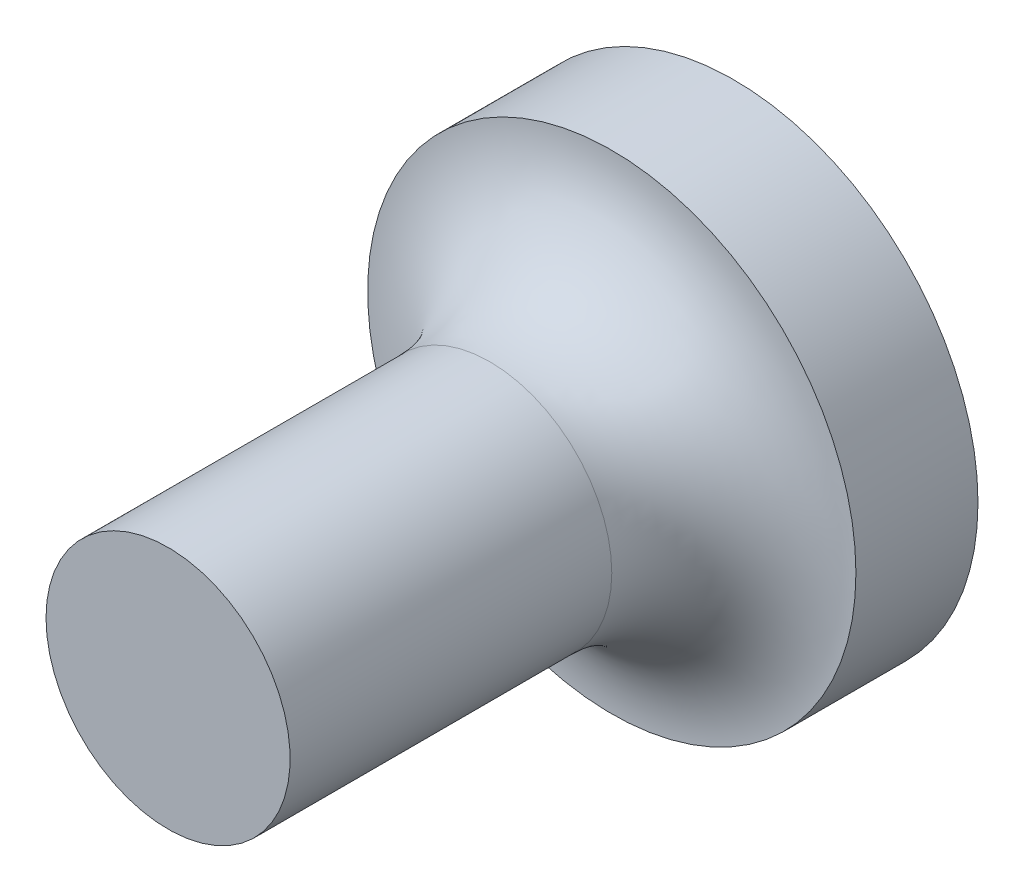
from build123d import *

# Parameters (mm, degrees)
ESQUISSE1_R        = 10
BOSS_EXTRU_1_DEPTH = 52.35
BOSS_EXTRU_2_START = 6
ESQUISSE2_R        = 20
BOSS_EXTRU_2_DEPTH = 10
CONG_1_R           = 10


with BuildPart() as part:
    # Esquisse1 → Boss.-Extru.1 (new body)
    with BuildSketch(Plane.XY):
        with Locations(Location((0, 0, 0), (0, 0, 180))):
            Circle(ESQUISSE1_R)
    extrude(amount=BOSS_EXTRU_1_DEPTH)

    # Esquisse2 → Boss.-Extru.2 (add)
    with BuildSketch(Plane.XY.offset(BOSS_EXTRU_2_START)):
        Circle(ESQUISSE2_R)
    extrude(amount=BOSS_EXTRU_2_DEPTH)

    # Congé1
    cong_1_edges = [part.edges().sort_by_distance(p)[0] for p in [
        (10, 0, 16),
    ]]
    fillet(cong_1_edges, radius=CONG_1_R - 0.0001)  # a hair under: the kernel refuses the full size


solid = part.part
